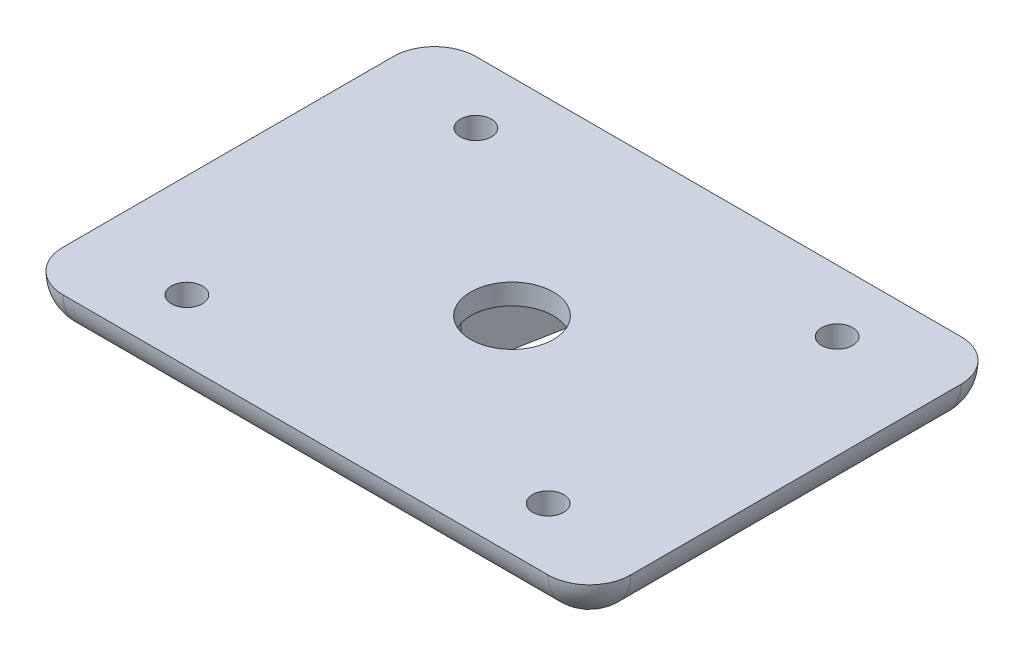
from build123d import *

# Parameters (mm, degrees)
SKETCH_1_W             = 55
SKETCH_1_H             = 40
EXTRUDE_1_DEPTH        = 4
CUT_EXTRUDE_START      = 4
SKETCH_1_6_OUTSIDE_W   = 70.624
SKETCH_1_6_OUTSIDE_H   = 55.624
SKETCH_1_6_OUTSIDE_W_2 = 55
SKETCH_1_6_OUTSIDE_H_2 = 40
SKETCH_1_6_OUTSIDE_R   = 4
SKETCH_1_6_OUTSIDE_R_2 = 1.5
CUT_EXTRUDE_5_DEPTH    = 5
FILLET_4_R             = 4
FILLET_6_R             = 4
FILLET_7_R             = 4
FILLET_8_R             = 4
SKETCH_2_R             = 9.705576387
EXTRUDE_2_DEPTH        = 3
CUT_EXTRUDE_START_2    = -5
CUT_EXTRUDE_7_DEPTH    = 5
SKETCH_4_R             = 0.44
CUT_EXTRUDE_8_DEPTH    = 2


with BuildPart() as part:
    # 草图1 → 凸台-拉伸1 (new body)
    with BuildSketch(Plane(origin=(0, 0, 0), x_dir=(1, 0, 0), z_dir=(0, 1, 0))):
        Rectangle(SKETCH_1_W, SKETCH_1_H)
    extrude(amount=EXTRUDE_1_DEPTH)

    # 草图1<6> outside → 切除-拉伸5 (cut)
    # profile 1 of 6: a face of its own
    with BuildSketch(Plane(origin=(0, 0, 0), x_dir=(1, 0, 0), z_dir=(0, 1, 0)).offset(CUT_EXTRUDE_START)):
        Rectangle(SKETCH_1_6_OUTSIDE_W, SKETCH_1_6_OUTSIDE_H)
        Rectangle(SKETCH_1_6_OUTSIDE_W_2, SKETCH_1_6_OUTSIDE_H_2, mode=Mode.SUBTRACT)
    # profile 2 of 6: a face of its own
    with BuildSketch(Plane(origin=(0, 0, 0), x_dir=(1, 0, 0), z_dir=(0, 1, 0)).offset(CUT_EXTRUDE_START)):
        with Locations(Location((0, 0, 0), (0, 0, 270))):
            Circle(SKETCH_1_6_OUTSIDE_R)
    # profile 3 of 6: a face of its own
    with BuildSketch(Plane(origin=(0, 0, 0), x_dir=(1, 0, 0), z_dir=(0, 1, 0)).offset(CUT_EXTRUDE_START)):
        with Locations(Location((-17.5, 14, 0), (0, 0, 270))):
            Circle(SKETCH_1_6_OUTSIDE_R_2)
    # profile 4 of 6: a face of its own
    with BuildSketch(Plane(origin=(0, 0, 0), x_dir=(1, 0, 0), z_dir=(0, 1, 0)).offset(CUT_EXTRUDE_START)):
        with Locations(Location((17.5, 14, 0), (0, 0, 270))):
            Circle(SKETCH_1_6_OUTSIDE_R_2)
    # profile 5 of 6: a face of its own
    with BuildSketch(Plane(origin=(0, 0, 0), x_dir=(1, 0, 0), z_dir=(0, 1, 0)).offset(CUT_EXTRUDE_START)):
        with Locations(Location((17.5, -14, 0), (0, 0, 270))):
            Circle(SKETCH_1_6_OUTSIDE_R_2)
    # profile 6 of 6: a face of its own
    with BuildSketch(Plane(origin=(0, 0, 0), x_dir=(1, 0, 0), z_dir=(0, 1, 0)).offset(CUT_EXTRUDE_START)):
        with Locations(Location((-17.5, -14, 0), (0, 0, 270))):
            Circle(SKETCH_1_6_OUTSIDE_R_2)
    extrude(amount=-CUT_EXTRUDE_5_DEPTH, mode=Mode.SUBTRACT)

    # 圆角4
    fillet_4_edges = [part.edges().sort_by_distance(p)[0] for p in [
        (27.5, 0, 0),
    ]]
    fillet(fillet_4_edges, radius=FILLET_4_R - 0.0001)  # a hair under: the kernel refuses the full size

    # 圆角6
    fillet_6_edges = [part.edges().sort_by_distance(p)[0] for p in [
        (26.328456414, 1.171543586, 20),
        (-1.99995, 0, 20),
    ]]
    fillet(fillet_6_edges, radius=FILLET_6_R - 0.0001)  # a hair under: the kernel refuses the full size

    # 圆角7
    fillet_7_edges = [part.edges().sort_by_distance(p)[0] for p in [
        (-27.5, 1.171543586, 18.828456414),
        (-27.5, 0, -1.99995),
    ]]
    fillet(fillet_7_edges, radius=FILLET_7_R - 0.0001)  # a hair under: the kernel refuses the full size

    # 圆角8
    fillet_8_edges = [part.edges().sort_by_distance(p)[0] for p in [
        (26.328456414, 1.171543586, -20),
        (0, 0, -20),
        (-26.328456414, 1.171543586, -20),
    ]]
    fillet(fillet_8_edges, radius=FILLET_8_R - 0.0001)  # a hair under: the kernel refuses the full size

    # 草图2 → 凸台-拉伸2 (add)
    with BuildSketch(Plane.XZ):
        with Locations(Location((0, 0, 0), (0, 0, 90))):
            Circle(SKETCH_2_R)
    extrude(amount=EXTRUDE_2_DEPTH)

    # 草图3 → 切除-拉伸7 (cut)
    with BuildSketch(Plane(origin=(0, -3, 0), x_dir=(-1, 0, 0), z_dir=(0, -1, 0)).offset(CUT_EXTRUDE_START_2)):
        with BuildLine():
            Line((3.226722166, -9.153495347), (4.917462581, 0))
            Line((4.917462581, 0), (3.226722166, 9.153495347))
            ThreePointArc((3.226722166, 9.153495347), (0, 9.705576387), (-3.226722166, 9.153495347))
            Line((-3.226722166, 9.153495347), (-4.917462581, 0))
            Line((-4.917462581, 0), (-3.226722166, -9.153495347))
            ThreePointArc((-3.226722166, -9.153495347), (0, -9.705576387), (3.226722166, -9.153495347))
        make_face()
    extrude(amount=CUT_EXTRUDE_7_DEPTH, mode=Mode.SUBTRACT)

    # 草图4 → 切除-拉伸8 (cut)
    with BuildSketch(Plane.XZ):
        with Locations(Location((0.243749782, -11.478919209, 0), (0, 0, 270))):
            Circle(SKETCH_4_R)
    extrude(amount=-CUT_EXTRUDE_8_DEPTH, mode=Mode.SUBTRACT)


solid = part.part
